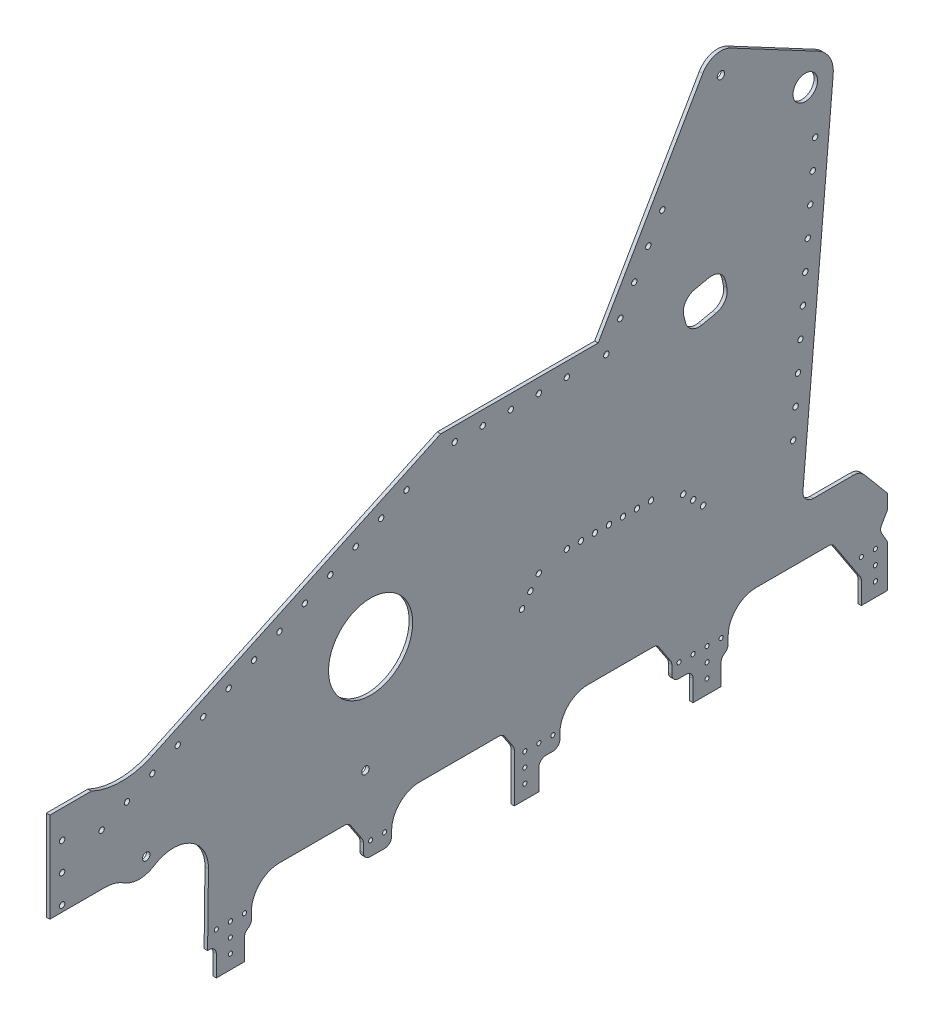
from build123d import *

# Parameters (mm, degrees)
BOSS_EXTRUDE1_DEPTH          = 3.175
F_1_4_CLEARANCE_HOLE1_D      = 6.7564
CUT_EXTRUDE4_START           = -3.175
CUT_EXTRUDE4_DEPTH           = 3.175
F_7_8_0_875_DIAMETER_HOLE1_D = 22.225
F_6_CLEARANCE_HOLE1_D        = 3.7973
SKETCH17_R                   = 38.1
CUT_EXTRUDE6_DEPTH           = 607.618253258
F_8_CLEARANCE_HOLE1_D        = 4.9149
F_8_CLEARANCE_HOLE2_D        = 4.9149
CUT_EXTRUDE9_DEPTH           = 607.618253258
FILLET1_R                    = 6.35
CUT_EXTRUDE10_DEPTH          = 607.618253258


# Read off the part's stored shape, not the designer's step: Cut-Extrude4
with BuildPart() as part:
    # Sketch1 → Boss-Extrude1 (new body)
    with BuildSketch(Plane(origin=(0, 0, 0), x_dir=(0, 0, -1), z_dir=(1, 0, 0))):
        with BuildLine():
            Line((-379.4125, -25.4), (379.4125, -25.4))
            Line((379.4125, -25.4), (379.4125, 12.7))
            Line((379.4125, 12.7), (373.913238686, 22.225))
            ThreePointArc((373.913238686, 22.225), (373.0625, 25.4), (373.913238686, 28.575))
            Line((373.913238686, 28.575), (379.4125, 38.1))
            Line((379.4125, 38.1), (379.4125, 50.8))
            Line((379.4125, 50.8), (358.317244618, 75.940346388))
            ThreePointArc((358.317244618, 75.940346388), (353.955732115, 79.28705264), (348.588480191, 80.476943745))
            Line((348.588480191, 80.476943745), (312.171609212, 80.476943745))
            ThreePointArc((312.171609212, 80.476943745), (305.149042579, 83.566947017), (302.682854713, 90.832102194))
            Line((302.682854713, 90.832102194), (330.103345332, 404.249744134))
            ThreePointArc((330.103345332, 404.249744134), (327.121530688, 418.584113341), (316.72300865, 428.891203064))
            Line((316.72300865, 428.891203064), (237.363712035, 471.080168083))
            ThreePointArc((237.363712035, 471.080168083), (223.169923354, 472.571242401), (211.923671605, 463.784390785))
            Line((211.923671605, 463.784390785), (117.237713163, 299.7835))
            Line((117.237713163, 299.7835), (-25.4, 299.7835))
            Line((-25.4, 299.7835), (-286.994459938, 177.8))
            ThreePointArc((-286.994459938, 177.8), (-314.449155618, 171.713440503), (-341.903851297, 177.8))
            Line((-341.903851297, 177.8), (-379.4125, 177.8))
            Line((-379.4125, 177.8), (-379.4125, 38.1))
            Line((-379.4125, 38.1), (-373.913238686, 28.575))
            ThreePointArc((-373.913238686, 28.575), (-373.0625, 25.4), (-373.913238686, 22.225))
            Line((-373.913238686, 22.225), (-379.4125, 12.7))
            Line((-379.4125, 12.7), (-379.4125, -25.4))
        make_face()
    extrude(amount=BOSS_EXTRUDE1_DEPTH)

    # 1/4 Clearance Hole1 (through all)
    with Locations(Plane(origin=(0, 0, 0), x_dir=(0, 0, -1), z_dir=(-1, 0, 0))):
        with Locations((-292.1, -101.6635), (-93.476017085, -69.9135), (228.421455547, -454.259390785)):
            Hole(F_1_4_CLEARANCE_HOLE1_D / 2)

    # Cut-Extrude4 outline → Cut-Extrude4 (cut)
    with BuildSketch(Plane(origin=(3.175, 0, 0), x_dir=(0, 0, -1), z_dir=(1, 0, 0)).offset(CUT_EXTRUDE4_START)):
        with BuildLine():
            Line((228.6, -6.35), (228.6, -25.4))
            Line((228.6, -25.4), (355.6, -25.4))
            Line((355.6, -25.4), (355.6, -5.68485798))
            ThreePointArc((355.6, -5.68485798), (355.335085484, -3.869855319), (354.562445777, -2.206292203))
            Line((354.562445777, -2.206292203), (331.164598945, 33.526765777))
            ThreePointArc((331.164598945, 33.526765777), (328.871557688, 35.634405899), (325.852153167, 36.3982))
            Line((325.852153167, 36.3982), (271.047846833, 36.3982))
            ThreePointArc((271.047846833, 36.3982), (268.028442312, 35.634405899), (265.735401055, 33.526765777))
            Line((265.735401055, 33.526765777), (255.263259125, 17.533770462))
            ThreePointArc((255.263259125, 17.533770462), (254.490619419, 15.870207345), (254.225704902, 14.055204685))
            Line((254.225704902, 14.055204685), (254.225704902, 9.041792552))
            ThreePointArc((254.225704902, 9.041792552), (253.733950669, 6.591597349), (252.334852451, 4.520896276))
            ThreePointArc((252.334852451, 4.520896276), (251.7695263, 3.882932401), (251.294738686, 3.175))
            ThreePointArc((251.294738686, 3.175), (248.970477372, 0.850738686), (245.795477372, 0))
            Line((245.795477372, 0), (234.95, 0))
            ThreePointArc((234.95, 0), (230.459871939, -1.859871939), (228.6, -6.35))
        make_face()
        with BuildLine():
            Line((63.5, -6.35), (63.5, -25.4))
            Line((63.5, -25.4), (203.2, -25.4))
            Line((203.2, -25.4), (203.2, -6.35))
            ThreePointArc((203.2, -6.35), (201.340128061, -1.859871939), (196.85, 0))
            Line((196.85, 0), (190.274295098, 0))
            ThreePointArc((190.274295098, 0), (185.784167037, 1.859871939), (183.924295098, 6.35))
            Line((183.924295098, 6.35), (183.924295098, 14.06007184))
            ThreePointArc((183.924295098, 14.06007184), (183.65487103, 15.890125483), (182.869461606, 17.564884481))
            Line((182.869461606, 17.564884481), (172.287094914, 33.553012641))
            ThreePointArc((172.287094914, 33.553012641), (169.99750154, 35.641859816), (166.991928406, 36.3982))
            Line((166.991928406, 36.3982), (112.297846833, 36.3982))
            ThreePointArc((112.297846833, 36.3982), (109.278442312, 35.634405899), (106.985401055, 33.526765777))
            Line((106.985401055, 33.526765777), (96.513259125, 17.533770462))
            ThreePointArc((96.513259125, 17.533770462), (95.740619419, 15.870207345), (95.475704902, 14.055204685))
            Line((95.475704902, 14.055204685), (95.475704902, 9.041792552))
            ThreePointArc((95.475704902, 9.041792552), (94.983950669, 6.591597349), (93.584852451, 4.520896276))
            ThreePointArc((93.584852451, 4.520896276), (93.0195263, 3.882932401), (92.544738686, 3.175))
            ThreePointArc((92.544738686, 3.175), (90.220477372, 0.850738686), (87.045477372, 0))
            Line((87.045477372, 0), (69.85, 0))
            ThreePointArc((69.85, 0), (65.359871939, -1.859871939), (63.5, -6.35))
        make_face()
        with BuildLine():
            Line((-50.8, 3.885825734), (-50.8, -25.4))
            Line((-50.8, -25.4), (41.275, -25.4))
            Line((41.275, -25.4), (41.275, 18.388947296))
            ThreePointArc((41.275, 18.388947296), (41.005575932, 20.219000939), (40.220166508, 21.893759937))
            Line((40.220166508, 21.893759937), (32.587094914, 33.426012641))
            ThreePointArc((32.587094914, 33.426012641), (30.29750154, 35.514859816), (27.291928406, 36.2712))
            Line((27.291928406, 36.2712), (-27.402153167, 36.2712))
            ThreePointArc((-27.402153167, 36.2712), (-30.421557688, 35.507405899), (-32.714598945, 33.399765777))
            Line((-32.714598945, 33.399765777), (-49.762445777, 7.364391511))
            ThreePointArc((-49.762445777, 7.364391511), (-50.535085484, 5.700828395), (-50.8, 3.885825734))
        make_face()
        with BuildLine():
            Line((-355.6, -25.4), (-228.6, -25.4))
            Line((-228.6, -25.4), (-228.6, -6.35))
            ThreePointArc((-228.6, -6.35), (-230.459871939, -1.859871939), (-234.95, 0))
            Line((-234.95, 0), (-236.651477372, 0))
            ThreePointArc((-236.651477372, 0), (-239.826477372, 0.850738686), (-242.150738686, 3.175))
            ThreePointArc((-242.150738686, 3.175), (-246.773772418, 6.289254743), (-252.071994637, 4.557242964))
            ThreePointArc((-252.071994637, 4.557242964), (-256.191826183, 2.771679177), (-260.462739274, 4.157518766))
            Line((-260.462739274, 4.157518766), (-281.5828125, 21.067110435))
            ThreePointArc((-281.5828125, 21.067110435), (-298.45, 26.9875), (-315.3171875, 21.067110435))
            Line((-315.3171875, 21.067110435), (-332.754905569, 7.10576243))
            ThreePointArc((-332.754905569, 7.10576243), (-339.366140336, 4.389137758), (-346.397468523, 5.673232251))
            ThreePointArc((-346.397468523, 5.673232251), (-352.582335902, 5.405371166), (-355.6, 0))
            Line((-355.6, 0), (-355.6, -25.4))
        make_face()
        with BuildLine():
            Line((-76.2, -25.4), (-76.2, -6.35))
            ThreePointArc((-76.2, -6.35), (-78.059871939, -1.859871939), (-82.55, 0))
            Line((-82.55, 0), (-89.125704902, 0))
            ThreePointArc((-89.125704902, 0), (-93.615832963, 1.859871939), (-95.475704902, 6.35))
            Line((-95.475704902, 6.35), (-95.475704902, 14.106934369))
            ThreePointArc((-95.475704902, 14.106934369), (-95.74512897, 15.936988012), (-96.530538394, 17.61174701))
            Line((-96.530538394, 17.61174701), (-107.023045357, 33.464112641))
            ThreePointArc((-107.023045357, 33.464112641), (-109.312638731, 35.552959816), (-112.318211865, 36.3093))
            Line((-112.318211865, 36.3093), (-167.160364491, 36.3093))
            ThreePointArc((-167.160364491, 36.3093), (-170.179769011, 35.545505899), (-172.472810268, 33.437865777))
            Line((-172.472810268, 33.437865777), (-182.886740875, 17.533770462))
            ThreePointArc((-182.886740875, 17.533770462), (-183.659380581, 15.870207345), (-183.924295098, 14.055204685))
            Line((-183.924295098, 14.055204685), (-183.924295098, 9.041792552))
            ThreePointArc((-183.924295098, 9.041792552), (-184.416049331, 6.591597349), (-185.815147549, 4.520896276))
            ThreePointArc((-185.815147549, 4.520896276), (-186.3804737, 3.882932401), (-186.855261314, 3.175))
            ThreePointArc((-186.855261314, 3.175), (-189.179522628, 0.850738686), (-192.354522628, 0))
            Line((-192.354522628, 0), (-196.85, 0))
            ThreePointArc((-196.85, 0), (-201.340128061, -1.859871939), (-203.2, -6.35))
            Line((-203.2, -6.35), (-203.2, -25.4))
            Line((-203.2, -25.4), (-76.2, -25.4))
        make_face()
    extrude(amount=CUT_EXTRUDE4_DEPTH, mode=Mode.SUBTRACT)

    # 7/8 (0.875) Diameter Hole1 (through all)
    with Locations(Plane(origin=(3.175, 0, 0), x_dir=(0, 0, -1), z_dir=(1, 0, 0))):
        with Locations((304.8, 406.4635)):
            Hole(F_7_8_0_875_DIAMETER_HOLE1_D / 2)

    # #6 Clearance Hole1 (through all)
    with Locations(Plane(origin=(0, -76.1365, 0), x_dir=(0, 0, 1), z_dir=(-1, 0, 0))):
        with Locations((-368.3, 63.4365), (-368.3, 76.1365), (-368.3, 88.8365), (-355.6, 88.8365), (-241.3, 88.8365), (-228.6, 88.8365), (-215.9, 63.4365), (-215.9, 76.1365), (-215.9, 88.8365), (-203.2, 88.8365), (-190.5, 88.8365), (-88.9, 88.8365), (-76.2, 88.8365), (-63.5, 88.8365), (-50.8, 63.4365), (-50.8, 76.1365), (-50.8, 88.8365), (63.5, 63.4365), (63.5, 76.1365), (63.5, 88.8365), (76.2, 88.8365), (88.9, 88.8365), (190.5, 88.8365), (203.2, 88.8365), (215.9, 63.4365), (215.9, 76.1365), (215.9, 88.8365), (228.6, 88.8365), (241.3, 88.8365), (254, 88.8365), (368.3, 63.4365), (342.9, 88.8365), (368.3, 76.1365), (355.6, 88.8365), (368.3, 88.8365)):
            Hole(F_6_CLEARANCE_HOLE1_D / 2)

    # Sketch17 → Cut-Extrude6 (cut, through all)
    with BuildSketch(Plane.ZY):
        with Locations((88.9, 164.666814763)):
            Circle(SKETCH17_R)
        with BuildLine():
            Line((329.389464266, 96.070700372), (403.37942113, 96.070700372))
            Line((403.37942113, 96.070700372), (395.251021391, -14.733123766))
            ThreePointArc((395.251021391, -14.733123766), (344.32658699, -138.735436098), (237.239855262, -58.098574984))
            Line((237.239855262, -58.098574984), (235.762860904, 63.936457128))
            ThreePointArc((235.762860904, 63.936457128), (252.138125247, 92.101116061), (284.699126993, 91.015546888))
            ThreePointArc((284.699126993, 91.015546888), (298.45, 86.971424102), (312.200873007, 91.015546888))
            ThreePointArc((312.200873007, 91.015546888), (320.43119649, 94.780705928), (329.389464266, 96.070700372))
        make_face()
    extrude(amount=-CUT_EXTRUDE6_DEPTH, mode=Mode.SUBTRACT)

    # #8 Clearance Hole1 (through all)
    with Locations(Plane(origin=(3.175, 0, 0), x_dir=(0, 0, -1), z_dir=(1, 0, 0))):
        with Locations((-368.3, 152.4635), (-368.3, 127.0635), (-368.3, 101.6635), (-332.579782209, 142.530315555), (-309.559564419, 153.264819403), (-286.539346628, 163.999323251), (-263.519128837, 174.733827099), (-240.498911046, 185.468330947), (-217.478693256, 196.202834796), (-194.458475465, 206.937338644), (-171.438257674, 217.671842492), (-148.418039883, 228.40634634), (-125.397822093, 239.140850189), (-102.377604302, 249.875354037), (-79.357386511, 260.609857885), (-56.337168721, 271.344361733), (-12.7, 287.0835), (12.7, 287.0835), (38.1, 287.0835), (63.5, 287.0835), (88.9, 287.0835), (124.570061582, 287.0835), (137.270061582, 309.080545256), (149.970061582, 331.077590512), (162.670061582, 353.074635768), (175.370061582, 375.071681024), (313.737453692, 362.902904929), (311.523697826, 337.599559597), (309.30994196, 312.296214266), (307.096186094, 286.992868934), (304.882430228, 261.689523603), (302.668674363, 236.386178271), (300.454918497, 211.08283294), (298.241162631, 185.779487608), (296.027406765, 160.476142277), (293.8136509, 135.172796945)):
            Hole(F_8_CLEARANCE_HOLE1_D / 2)

    # #8 Clearance Hole2 (through all)
    with Locations(Plane.ZY):
        with Locations((-165.1, 152.3365), (-152.4, 152.3365), (-114.3, 152.3365), (-139.7, 152.3365), (-88.9, 152.3365), (-101.6, 152.3365), (-127, 152.3365), (-194.274710368, 142.696831256), (-203.277445122, 133.739110175), (-212.280179876, 124.781389095), (-63.482153513, 145.96297655), (-55.837713392, 135.821352655), (-48.19327327, 125.67972876)):
            Hole(F_8_CLEARANCE_HOLE2_D / 2)

    # Sketch31 → Cut-Extrude9 (cut, through all)
    with BuildSketch(Plane.ZY):
        with BuildLine():
            Line((-271.047846833, 36.3982), (-260.35, 36.3982))
            ThreePointArc((-260.35, 36.3982), (-242.389487758, 28.958712242), (-234.95, 10.9982))
            Line((-234.95, 10.9982), (-234.95, -31.452073522))
            Line((-234.95, -31.452073522), (-271.047846833, -31.452073522))
            Line((-271.047846833, -31.452073522), (-271.047846833, 36.3982))
        make_face()
        with BuildLine():
            Line((-112.297846833, 36.3982), (-107.95, 36.3982))
            ThreePointArc((-107.95, 36.3982), (-89.989487758, 28.958712242), (-82.55, 10.9982))
            Line((-82.55, 10.9982), (-82.55, -31.129161121))
            Line((-82.55, -31.129161121), (-112.297846833, -31.129161121))
            Line((-112.297846833, -31.129161121), (-112.297846833, 36.3982))
        make_face()
        with BuildLine():
            Line((167.160364491, 36.3093), (171.45, 36.3093))
            ThreePointArc((171.45, 36.3093), (189.410512242, 28.869812242), (196.85, 10.9093))
            Line((196.85, 10.9093), (196.85, -32.555748108))
            Line((196.85, -32.555748108), (167.160364491, -32.555748108))
            Line((167.160364491, -32.555748108), (167.160364491, 36.3093))
        make_face()
        with BuildLine():
            Line((27.402153167, 36.2712), (44.45, 36.2712))
            ThreePointArc((44.45, 36.2712), (62.410512242, 28.831712242), (69.85, 10.8712))
            Line((69.85, 10.8712), (69.85, 0))
            Line((69.85, 0), (82.55, 0))
            Line((82.55, 0), (82.55, -48.636546881))
            Line((82.55, -48.636546881), (37.82050367, -49.590427789))
            Line((37.82050367, -49.590427789), (27.402153167, 36.2712))
        make_face()
    extrude(amount=-CUT_EXTRUDE9_DEPTH, mode=Mode.SUBTRACT)

    # Fillet1
    fillet1_edges = [part.edges().sort_by_distance(p)[0] for p in [
        (1.5875, 0, -82.55),
        (1.5875, 0, 69.85),
        (1.5875, 0, 196.85),
        (1.5875, 0, -234.95),
    ]]
    fillet(fillet1_edges, radius=FILLET1_R)

    # Sketch32 → Cut-Extrude10 (cut, through all)
    with BuildSketch(Plane.ZY):
        with BuildLine():
            Line((-217.471680003, 300.795220637), (-204.402061137, 298.017187388))
            ThreePointArc((-204.402061137, 298.017187388), (-196.271463075, 292.323301884), (-194.720574818, 282.519134271))
            Line((-194.720574818, 282.519134271), (-196.254559203, 276.373395821))
            ThreePointArc((-196.254559203, 276.373395821), (-201.84793497, 268.677897874), (-211.217002469, 267.02649988))
            Line((-211.217002469, 267.02649988), (-224.068795422, 269.758232801))
            ThreePointArc((-224.068795422, 269.758232801), (-232.079433161, 275.263791586), (-233.850791478, 284.821185804))
            Line((-233.850791478, 284.821185804), (-232.534633006, 291.013224581))
            ThreePointArc((-232.534633006, 291.013224581), (-227.029074221, 299.02386232), (-217.471680003, 300.795220637))
        make_face()
    extrude(amount=-CUT_EXTRUDE10_DEPTH, mode=Mode.SUBTRACT)


solid = part.part
